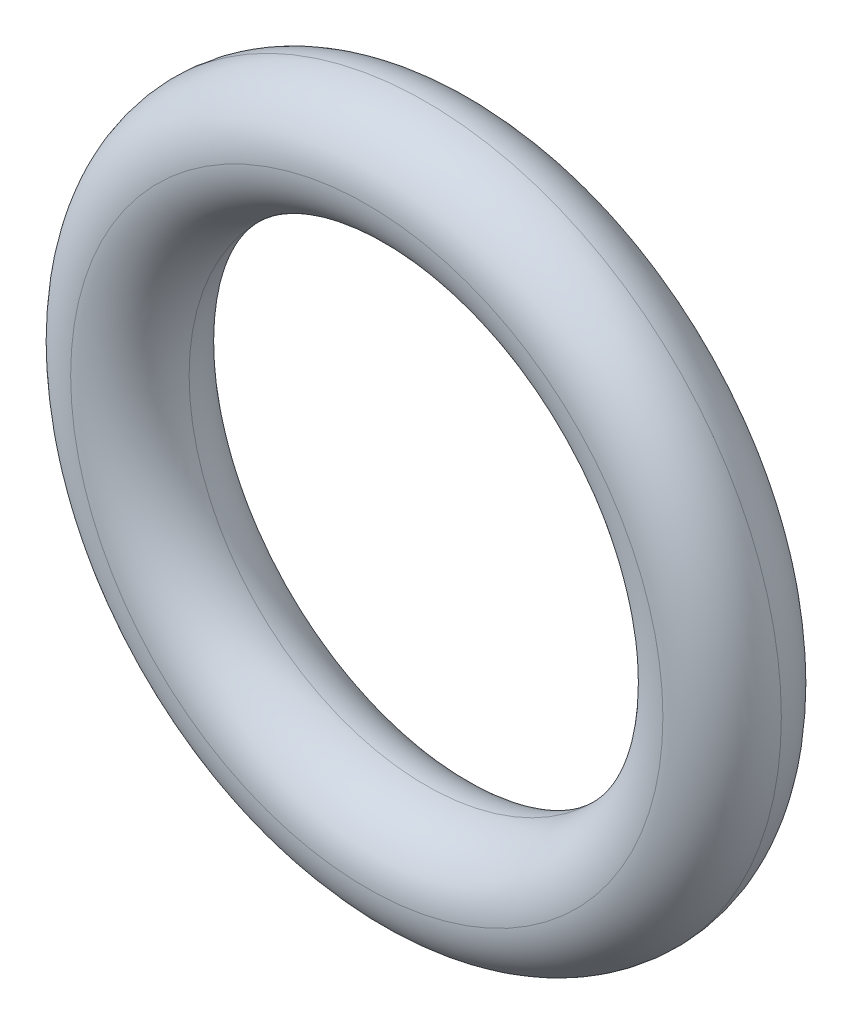
from build123d import *

# Parameters (mm, degrees)
SKETCH1_R           = 76.2
SKETCH1_R_2         = 50.8
BOSS_EXTRUDE1_DEPTH = 25.4
FILLET1_R           = 12.7
FILLET2_R           = 12.7


with BuildPart() as part:
    # Sketch1 → Boss-Extrude1 (new body)
    with BuildSketch(Plane.XY):
        Circle(SKETCH1_R)
        Circle(SKETCH1_R_2, mode=Mode.SUBTRACT)
    extrude(amount=BOSS_EXTRUDE1_DEPTH)

    # Fillet1
    fillet1_edges = [part.edges().sort_by_distance(p)[0] for p in [
        (-76.2, 0, 0),
        (-76.2, 0, 25.4),
    ]]
    fillet(fillet1_edges, radius=FILLET1_R - 0.0001)  # a hair under: the kernel refuses the full size

    # Fillet2
    fillet2_edges = [part.edges().sort_by_distance(p)[0] for p in [
        (-50.8, 0, 0),
        (-50.8, 0, 25.4),
    ]]
    fillet(fillet2_edges, radius=FILLET2_R - 0.0001)  # a hair under: the kernel refuses the full size


solid = part.part
